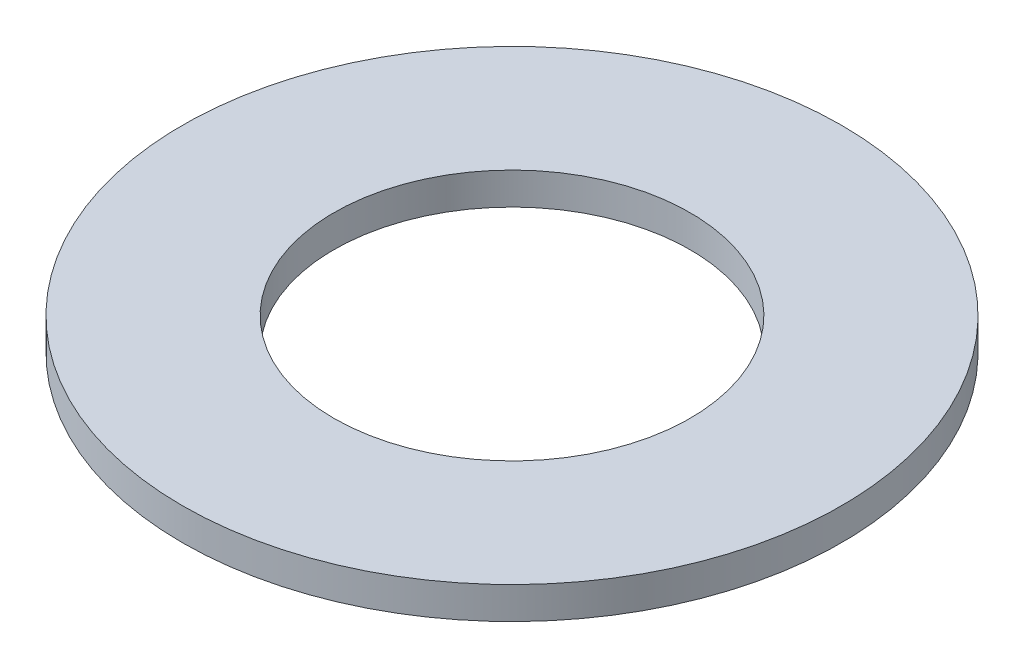
from build123d import *

# Parameters (mm, degrees)
SKETCH1_R           = 92.5
BOSS_EXTRUDE1_DEPTH = 9
SKETCH2_R           = 50
CUT_EXTRUDE1_DEPTH  = 132.123987127


with BuildPart() as part:
    # Sketch1 → Boss-Extrude1 (new body)
    with BuildSketch(Plane(origin=(0, 0, 0), x_dir=(1, 0, 0), z_dir=(0, 1, 0))):
        Circle(SKETCH1_R)
    extrude(amount=BOSS_EXTRUDE1_DEPTH)

    # Sketch2 → Cut-Extrude1 (cut, through all)
    with BuildSketch(Plane(origin=(0, 0, 0), x_dir=(1, 0, 0), z_dir=(0, 1, 0))):
        Circle(SKETCH2_R)
    extrude(amount=CUT_EXTRUDE1_DEPTH, mode=Mode.SUBTRACT)


solid = part.part
